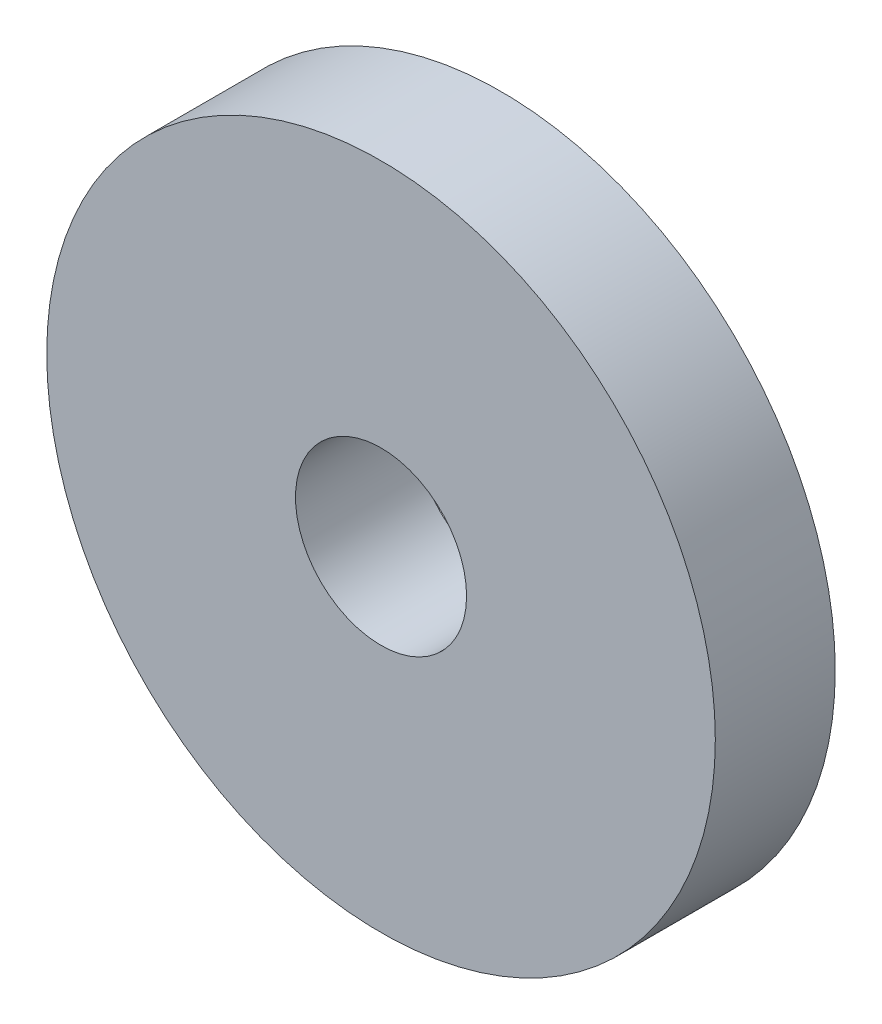
from build123d import *

# Parameters (mm, degrees)
SKETCH1_R           = 12.7
SKETCH1_R_2         = 3.25
BOSS_EXTRUDE1_DEPTH = 2.27825


with BuildPart() as part:
    # Sketch1 → Boss-Extrude1 (new, symmetric)
    with BuildSketch(Plane.XY):
        Circle(SKETCH1_R)
        Circle(SKETCH1_R_2, mode=Mode.SUBTRACT)
    extrude(amount=BOSS_EXTRUDE1_DEPTH, both=True)


solid = part.part
